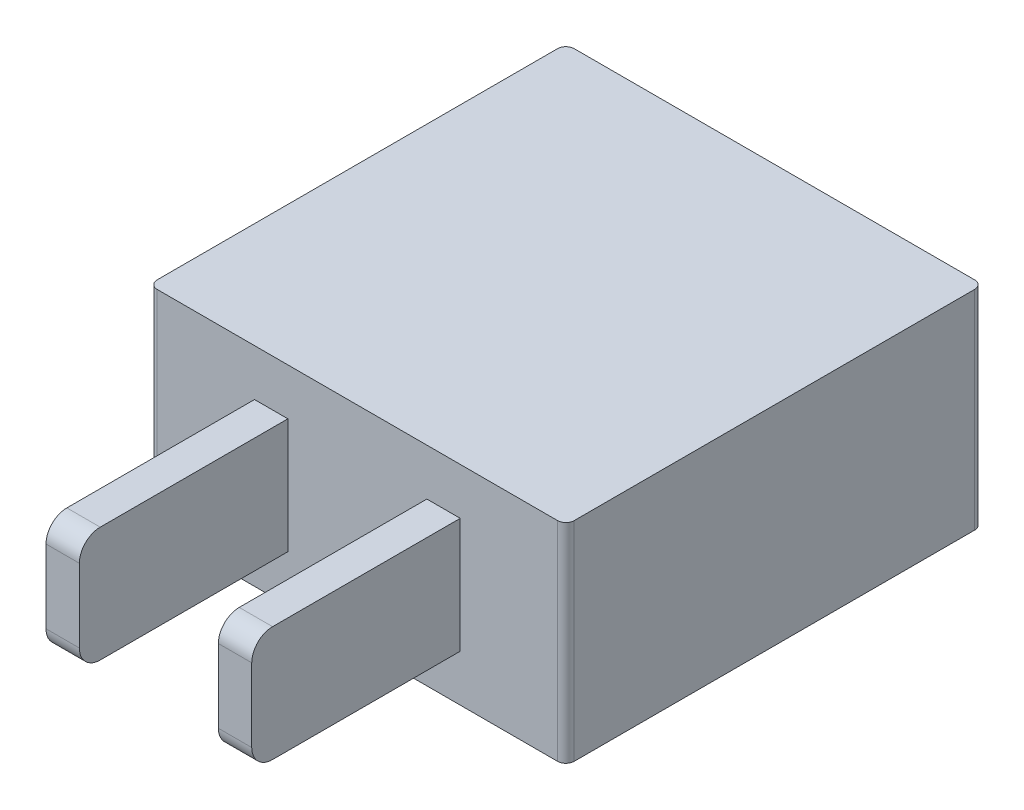
from build123d import *

# Parameters (mm, degrees)
SKETCH1_W           = 12.7
SKETCH1_H           = 12.7
BOSS_EXTRUDE1_DEPTH = 6.35
SKETCH2_W           = 1.016
SKETCH2_H           = 3.5052
BOSS_EXTRUDE2_DEPTH = 6.35
FILLET1_R           = 0.635
FILLET2_R           = 0.254


with BuildPart() as part:
    # Sketch1 → Boss-Extrude1 (new body)
    with BuildSketch(Plane(origin=(0, 0, 0), x_dir=(1, 0, 0), z_dir=(0, 1, 0))):
        Rectangle(SKETCH1_W, SKETCH1_H)
    extrude(amount=BOSS_EXTRUDE1_DEPTH)

    # Sketch2 → Boss-Extrude2 (add)
    with BuildSketch(Plane.XY.offset(6.35)):
        with Locations((2.624666667, 3.175)):
            Rectangle(SKETCH2_W, SKETCH2_H)
        with Locations((-2.624666667, 3.175)):
            Rectangle(SKETCH2_W, SKETCH2_H)
    extrude(amount=BOSS_EXTRUDE2_DEPTH)

    # Fillet1
    fillet1_edges = [part.edges().sort_by_distance(p)[0] for p in [
        (2.624666667, 4.9276, 12.7),
        (2.624666667, 1.4224, 12.7),
        (-2.624666667, 1.4224, 12.7),
        (-2.624666667, 4.9276, 12.7),
    ]]
    fillet(fillet1_edges, radius=FILLET1_R)

    # Fillet2
    fillet2_edges = [part.edges().sort_by_distance(p)[0] for p in [
        (-6.35, 3.175, -6.35),
        (6.35, 3.175, -6.35),
        (6.35, 3.175, 6.35),
        (-6.35, 3.175, 6.35),
    ]]
    fillet(fillet2_edges, radius=FILLET2_R)


solid = part.part
